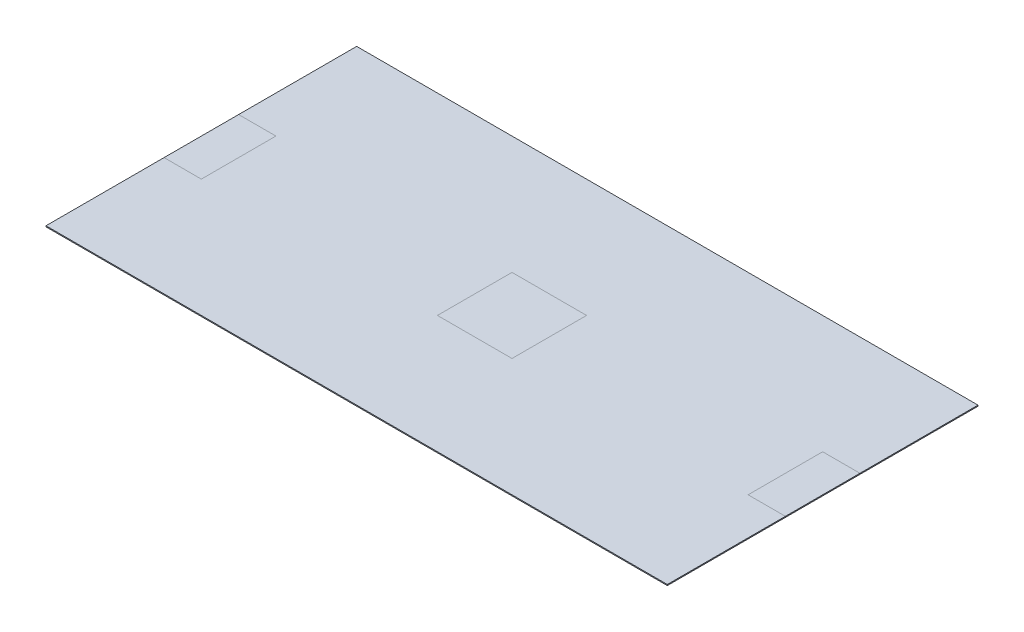
from build123d import *

# Parameters (mm, degrees)
SKETCH1_W              = 2500
SKETCH1_H              = 1250
BOSS_EXTRUDE1_DEPTH    = 4
SPLIT1_SURFACE_1_BACK  = 2796.088
SPLIT1_SURFACE_1_DEPTH = 5592.176
SPLIT1_SURFACE_2_BACK  = 2796.088
SPLIT1_SURFACE_2_DEPTH = 5592.176
SPLIT2_START           = -150
SPLIT2_OUTLINE_W       = 150
SPLIT2_OUTLINE_H       = 4
SPLIT2_DEPTH           = 300
SPLIT2_2_OUTLINE_W     = 150
SPLIT2_2_OUTLINE_H     = 4
SPLIT2_2_DEPTH         = 300
SPLIT2_3_OUTLINE_W     = 150
SPLIT2_3_OUTLINE_H     = 4
SPLIT2_3_DEPTH         = 300


# Read off the part's stored shape, not the designer's step: Split2
with BuildPart() as part:
    # Sketch1 → Boss-Extrude1 (new body)
    with BuildSketch(Plane(origin=(0, 0, 0), x_dir=(1, 0, 0), z_dir=(0, 1, 0))):
        Rectangle(SKETCH1_W, SKETCH1_H)
    extrude(amount=BOSS_EXTRUDE1_DEPTH)


with BuildPart() as body_2:
    # Split1: the piece behind the surface
    add(part.part)
    # Split1 surface: a surface, the sketch's curves swept straight by 5592.176 mm
    with BuildLine(Plane(origin=(0, 4, 0), x_dir=(1, 0, 0), z_dir=(0, 1, 0)).offset(-SPLIT1_SURFACE_1_BACK), mode=Mode.PRIVATE) as split1_surface_1_path:
        Line((-150, -150), (150, -150))
        Line((150, -150), (150, 150))
        Line((150, 150), (-150, 150))
        Line((-150, 150), (-150, -150))
    split1_surface_1 = Shell.extrude(split1_surface_1_path.wire(), (0 * SPLIT1_SURFACE_1_DEPTH, 1 * SPLIT1_SURFACE_1_DEPTH, 0 * SPLIT1_SURFACE_1_DEPTH))
    split(bisect_by=split1_surface_1, keep=Keep.BOTTOM)

    # Split2 2 outline → Split2 2 (cut)
    with BuildSketch(Plane.XY.offset(SPLIT2_START)):
        with Locations((-1175, 2)):
            Rectangle(SPLIT2_2_OUTLINE_W, SPLIT2_2_OUTLINE_H)
        with Locations((1175, 2)):
            Rectangle(SPLIT2_2_OUTLINE_W, SPLIT2_2_OUTLINE_H)
    extrude(amount=SPLIT2_2_DEPTH, mode=Mode.SUBTRACT)


with BuildPart() as part_1:
    add(part.part)

    # Split1: split by a surface, the side it looks to stays
    # Split1 surface: a surface, the sketch's curves swept straight by 5592.176 mm
    with BuildLine(Plane(origin=(0, 4, 0), x_dir=(1, 0, 0), z_dir=(0, 1, 0)).offset(-SPLIT1_SURFACE_2_BACK), mode=Mode.PRIVATE) as split1_surface_2_path:
        Line((-150, -150), (150, -150))
        Line((150, -150), (150, 150))
        Line((150, 150), (-150, 150))
        Line((-150, 150), (-150, -150))
    split1_surface_2 = Shell.extrude(split1_surface_2_path.wire(), (0 * SPLIT1_SURFACE_2_DEPTH, 1 * SPLIT1_SURFACE_2_DEPTH, 0 * SPLIT1_SURFACE_2_DEPTH))
    split(bisect_by=split1_surface_2, keep=Keep.TOP)


with BuildPart() as body_3:
    # Split2 outline → Split2 (new body)
    with BuildSketch(Plane.XY.offset(SPLIT2_START)):
        with Locations((-1175, 2)):
            Rectangle(SPLIT2_OUTLINE_W, SPLIT2_OUTLINE_H)
    extrude(amount=SPLIT2_DEPTH)


with BuildPart() as body_4:
    # Split2 3 outline → Split2 3 (new body)
    with BuildSketch(Plane.XY.offset(SPLIT2_START)):
        with Locations((1175, 2)):
            Rectangle(SPLIT2_3_OUTLINE_W, SPLIT2_3_OUTLINE_H)
    extrude(amount=SPLIT2_3_DEPTH)


solid = Compound([body_2.part, part_1.part, body_3.part, body_4.part])
